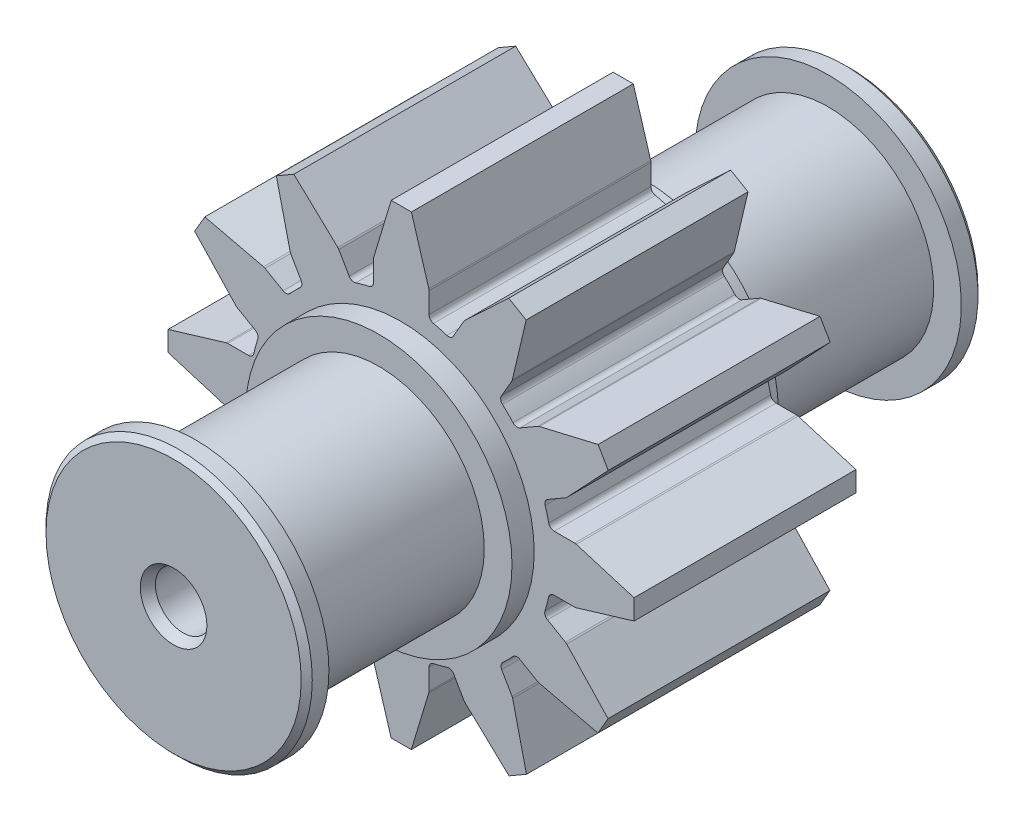
from build123d import *

# Parameters (mm, degrees)
EXTRUDE_1_DEPTH      = 20
SKETCH_3_R           = 12
EXTRUDE_2_DEPTH      = 2
EXTRUDE_START        = 2
SKETCH_4_R           = 12
EXTRUDE_3_DEPTH      = 2
SKETCH_5_R           = 9.5
EXTRUDE_4_DEPTH      = 16.5
SKETCH_6_R           = 12
EXTRUDE_5_DEPTH      = 2
CHAMFER_2_SIZE       = 0.5
EXTRUDE_START_2      = 16.5
SKETCH_7_R           = 9.5
EXTRUDE_6_DEPTH      = 16.5
SKETCH_8_R           = 12
EXTRUDE_7_DEPTH      = 2
CHAMFER_3_SIZE       = 0.5
SKETCH_15_R          = 2.5
CUT_EXTRUDE_13_DEPTH = 74
CHAMFER_6_SIZE       = 0.5
CHAMFER_6_SIZE2      = 0.866025404
CHAMFER_9_SIZE       = 0.5
CHAMFER_9_SIZE2      = 0.866025404


with BuildPart() as part:
    # Эскиз2 → Вытянуть1 (new body)
    with BuildSketch(Plane.XY):
        with BuildLine():
            Line((53.764538287, -2.946020686), (53.764538287, -1.077143616))
            ThreePointArc((53.764538287, -1.077143616), (53.759197394, -1.004257629), (53.743288818, -0.932928746))
            Line((53.743288818, -0.932928746), (52.174732421, 4.274212553))
            Line((52.174732421, 4.274212553), (50.354570926, 4.274212553))
            Line((50.354570926, 4.274212553), (48.785793437, -0.932919949))
            ThreePointArc((48.785793437, -0.932919949), (48.769880615, -1.004257948), (48.764538287, -1.077153679))
            Line((48.764538287, -1.077153679), (48.764538287, -2.953138509))
            ThreePointArc((48.764538287, -2.953138509), (48.653798767, -3.266947811), (48.370633173, -3.441752748))
            ThreePointArc((48.370633173, -3.441752748), (47.755574297, -3.590379289), (47.148101498, -3.767478327))
            ThreePointArc((47.148101498, -3.767478327), (46.816157953, -3.756991645), (46.564008916, -3.540849677))
            Line((46.564008916, -3.540849677), (45.628704767, -1.920855369))
            ThreePointArc((45.628704767, -1.920855369), (45.587636424, -1.860404698), (45.538194752, -1.806586362))
            Line((45.538194752, -1.806586362), (41.576214415, 1.918652085))
            Line((41.576214415, 1.918652085), (39.999908322, 1.008571338))
            Line((39.999908322, 1.008571338), (41.244873414, -4.285326434))
            ThreePointArc((41.244873414, -4.285326434), (41.266761505, -4.355063364), (41.298582779, -4.420864083))
            Line((41.298582779, -4.420864083), (42.233043669, -6.039397823))
            ThreePointArc((42.233043669, -6.039397823), (42.29400173, -6.366811555), (42.135803463, -6.659879713))
            ThreePointArc((42.135803463, -6.659879713), (41.671118276, -7.10145189), (41.227792451, -7.564464333))
            ThreePointArc((41.227792451, -7.564464333), (40.935062472, -7.721409797), (40.608582641, -7.660306282))
            Line((40.608582641, -7.660306282), (38.980519219, -6.720343428))
            ThreePointArc((38.980519219, -6.720343428), (38.914727656, -6.688525782), (38.845000744, -6.666638572))
            Line((38.845000744, -6.666638572), (33.551205899, -5.42147761))
            Line((33.551205899, -5.42147761), (32.641125152, -6.997783703))
            Line((32.641125152, -6.997783703), (36.36624071, -10.959946087))
            ThreePointArc((36.36624071, -10.959946087), (36.42007011, -11.009400187), (36.480534902, -11.050477203))
            Line((36.480534902, -11.050477203), (38.099195221, -11.984952893))
            ThreePointArc((38.099195221, -11.984952893), (38.3156739, -12.237948594), (38.325284093, -12.570781115))
            ThreePointArc((38.325284093, -12.570781115), (38.135802793, -13.215524272), (37.978453065, -13.868852647))
            ThreePointArc((37.978453065, -13.868852647), (37.803845806, -14.152755097), (37.48960436, -14.263843393))
            Line((37.48960436, -14.263843393), (35.609921104, -14.263843393))
            ThreePointArc((35.609921104, -14.263843393), (35.536992217, -14.269190608), (35.465623196, -14.285117883))
            Line((35.465623196, -14.285117883), (30.241497591, -15.859778889))
            Line((30.241497591, -15.859778889), (30.258564934, -17.673810753))
            Line((30.258564934, -17.673810753), (35.465697436, -19.242588243))
            ThreePointArc((35.465697436, -19.242588243), (35.537035435, -19.258501065), (35.609931166, -19.263843393))
            Line((35.609931166, -19.263843393), (37.515142589, -19.263843393))
            ThreePointArc((37.515142589, -19.263843393), (37.828138332, -19.373928448), (38.003309462, -19.655708734))
            ThreePointArc((38.003309462, -19.655708734), (38.149518751, -20.25162588), (38.322513601, -20.840325449))
            ThreePointArc((38.322513601, -20.840325449), (38.312380747, -21.172625221), (38.09610656, -21.425115396))
            Line((38.09610656, -21.425115396), (36.477531273, -22.359600274))
            ThreePointArc((36.477531273, -22.359600274), (36.417080602, -22.400668616), (36.363262266, -22.450110289))
            Line((36.363262266, -22.450110289), (32.638023819, -26.412090625))
            Line((32.638023819, -26.412090625), (33.548104566, -27.988396718))
            Line((33.548104566, -27.988396718), (38.837821827, -26.744414757))
            ThreePointArc((38.837821827, -26.744414757), (38.911454943, -26.720963772), (38.980594997, -26.686446567))
            Line((38.980594997, -26.686446567), (40.557311134, -25.740478688))
            ThreePointArc((40.557311134, -25.740478688), (40.887974912, -25.674653662), (41.185251899, -25.833706677))
            ThreePointArc((41.185251899, -25.833706677), (41.655272975, -26.327509287), (42.149482788, -26.797102185))
            ThreePointArc((42.149482788, -26.797102185), (42.308189645, -27.09030597), (42.247291035, -27.418098106))
            Line((42.247291035, -27.418098106), (41.313149687, -29.036078382))
            ThreePointArc((41.313149687, -29.036078382), (41.281332042, -29.101869945), (41.259444832, -29.171596858))
            Line((41.259444832, -29.171596858), (40.014283869, -34.465391703))
            Line((40.014283869, -34.465391703), (41.590589962, -35.37547245))
            Line((41.590589962, -35.37547245), (45.552970023, -31.650152239))
            ThreePointArc((45.552970023, -31.650152239), (45.602242473, -31.596552031), (45.643208409, -31.536364418))
            Line((45.643208409, -31.536364418), (46.589687492, -29.901332509))
            ThreePointArc((46.589687492, -29.901332509), (46.841408349, -29.685740418), (47.172658361, -29.674934436))
            ThreePointArc((47.172658361, -29.674934436), (47.763729285, -29.846529298), (48.361967201, -29.991170333))
            ThreePointArc((48.361967201, -29.991170333), (48.644883646, -30.166041654), (48.75550534, -30.479704745))
            Line((48.75550534, -30.479704745), (48.75550534, -32.34734856))
            ThreePointArc((48.75550534, -32.34734856), (48.760846232, -32.420234547), (48.776754809, -32.49156343))
            Line((48.776754809, -32.49156343), (50.345311205, -37.698704729))
            Line((50.345311205, -37.698704729), (52.1654727, -37.698704729))
            Line((52.1654727, -37.698704729), (53.734250189, -32.491572227))
            ThreePointArc((53.734250189, -32.491572227), (53.750163012, -32.420234228), (53.75550534, -32.347338497))
            Line((53.75550534, -32.347338497), (53.75550534, -30.477514017))
            ThreePointArc((53.75550534, -30.477514017), (53.866087201, -30.163900379), (54.148919394, -29.989006661))
            ThreePointArc((54.148919394, -29.989006661), (54.776030579, -29.836482847), (55.395187259, -29.654337418))
            ThreePointArc((55.395187259, -29.654337418), (55.727840657, -29.664117847), (55.980669977, -29.880523195))
            Line((55.980669977, -29.880523195), (56.918293093, -31.50453407))
            ThreePointArc((56.918293093, -31.50453407), (56.959361435, -31.564984741), (57.008803108, -31.618803077))
            Line((57.008803108, -31.618803077), (60.970783444, -35.344041525))
            Line((60.970783444, -35.344041525), (62.547089537, -34.433960777))
            Line((62.547089537, -34.433960777), (61.302124446, -29.140063005))
            ThreePointArc((61.302124446, -29.140063005), (61.280236354, -29.070326075), (61.248415081, -29.004525356))
            Line((61.248415081, -29.004525356), (60.313352567, -27.384949575))
            ThreePointArc((60.313352567, -27.384949575), (60.252285616, -27.058233892), (60.409547147, -26.765418044))
            ThreePointArc((60.409547147, -26.765418044), (60.874734414, -26.320800568), (61.318355435, -25.854662946))
            ThreePointArc((61.318355435, -25.854662946), (61.611362594, -25.69669226), (61.938606865, -25.757676849))
            Line((61.938606865, -25.757676849), (63.556770089, -26.691923822))
            ThreePointArc((63.556770089, -26.691923822), (63.622561652, -26.723741467), (63.692288565, -26.745628677))
            Line((63.692288565, -26.745628677), (68.986083409, -27.990789639))
            Line((68.986083409, -27.990789639), (69.896164156, -26.414483546))
            Line((69.896164156, -26.414483546), (66.171043874, -22.452316137))
            ThreePointArc((66.171043874, -22.452316137), (66.117219766, -22.402866229), (66.056761375, -22.361791772))
            Line((66.056761375, -22.361791772), (64.43714748, -21.426707253))
            ThreePointArc((64.43714748, -21.426707253), (64.220913014, -21.174319639), (64.210673714, -20.84212691))
            ThreePointArc((64.210673714, -20.84212691), (64.390016693, -20.228801746), (64.540344527, -19.607727513))
            ThreePointArc((64.540344527, -19.607727513), (64.715163733, -19.324615398), (65.028941656, -19.213901173))
            Line((65.028941656, -19.213901173), (66.888769323, -19.213901173))
            ThreePointArc((66.888769323, -19.213901173), (66.961655311, -19.208560281), (67.032984194, -19.192651704))
            Line((67.032984194, -19.192651704), (72.240125492, -17.624095307))
            Line((72.240125492, -17.624095307), (72.240125492, -15.803933813))
            Line((72.240125492, -15.803933813), (67.033013036, -14.235162363))
            ThreePointArc((67.033013036, -14.235162363), (66.961654766, -14.219246553), (66.888738326, -14.213907214))
            Line((66.888738326, -14.213907214), (65.038418761, -14.214058869))
            ThreePointArc((65.038418761, -14.214058869), (64.724765213, -14.103477871), (64.549862276, -13.820607462))
            ThreePointArc((64.549862276, -13.820607462), (64.40200748, -13.210628208), (64.226184375, -12.608115166))
            ThreePointArc((64.226184375, -12.608115166), (64.236662079, -12.276162568), (64.452807408, -12.024004868))
            Line((64.452807408, -12.024004868), (66.072795877, -11.088704089))
            ThreePointArc((66.072795877, -11.088704089), (66.133246547, -11.047635747), (66.187064884, -10.998194074))
            Line((66.187064884, -10.998194074), (69.912303331, -7.036213738))
            Line((69.912303331, -7.036213738), (69.002222584, -5.459907645))
            Line((69.002222584, -5.459907645), (63.708324812, -6.704872737))
            ThreePointArc((63.708324812, -6.704872737), (63.638587881, -6.726760828), (63.572787163, -6.758582102))
            Line((63.572787163, -6.758582102), (61.954455243, -7.692926471))
            ThreePointArc((61.954455243, -7.692926471), (61.626900937, -7.75386248), (61.3337823, -7.595475342))
            ThreePointArc((61.3337823, -7.595475342), (60.870851004, -7.108824873), (60.384451797, -6.645629585))
            ThreePointArc((60.384451797, -6.645629585), (60.226244716, -6.352559068), (60.287201748, -6.025138774))
            Line((60.287201748, -6.025138774), (61.21857227, -4.41195771))
            ThreePointArc((61.21857227, -4.41195771), (61.250389916, -4.346166146), (61.272277126, -4.276439234))
            Line((61.272277126, -4.276439234), (62.517438088, 1.017355611))
            Line((62.517438088, 1.017355611), (60.941131995, 1.927436358))
            Line((60.941131995, 1.927436358), (56.978964585, -1.797683924))
            ThreePointArc((56.978964585, -1.797683924), (56.929514677, -1.851508033), (56.88844022, -1.911966424))
            Line((56.88844022, -1.911966424), (55.953232083, -3.531794433))
            ThreePointArc((55.953232083, -3.531794433), (55.70097994, -3.747976393), (55.368928673, -3.758356204))
            ThreePointArc((55.368928673, -3.758356204), (54.767086452, -3.582459006), (54.157776241, -3.434489586))
            ThreePointArc((54.157776241, -3.434489586), (53.875063626, -3.259564126), (53.764538287, -2.946020686))
        make_face()
    extrude(amount=EXTRUDE_1_DEPTH)

    # Эскиз3 → Вытянуть2 (add)
    with BuildSketch(Plane(origin=(0, 0, 0), x_dir=(-1, 0, 0), z_dir=(0, 0, -1))):
        with Locations((-51.240125492, -16.733104028)):
            Circle(SKETCH_3_R)
    extrude(amount=EXTRUDE_2_DEPTH)

    # Эскиз4 → Вытянуть3 (add)
    with BuildSketch(Plane.XY.offset(20).offset(EXTRUDE_START)):
        with Locations((51.240125492, -16.733104028)):
            Circle(SKETCH_4_R)
    extrude(amount=-EXTRUDE_3_DEPTH)

    # Эскиз5 → Вытянуть4 (add)
    with BuildSketch(Plane(origin=(0, 0, -2), x_dir=(-1, 0, 0), z_dir=(0, 0, -1))):
        with Locations((-51.240125492, -16.733104028)):
            Circle(SKETCH_5_R)
    extrude(amount=EXTRUDE_4_DEPTH)

    # Эскиз6 → Вытянуть5 (add)
    with BuildSketch(Plane(origin=(0, 0, -18.5), x_dir=(-1, 0, 0), z_dir=(0, 0, -1))):
        with Locations((-51.240125492, -16.733104028)):
            Circle(SKETCH_6_R)
    extrude(amount=EXTRUDE_5_DEPTH)

    # Фаска2
    chamfer_2_edges = [part.edges().sort_by_distance(p)[0] for p in [
        (63.240125492, -16.733104028, -20.5),
    ]]
    chamfer(chamfer_2_edges, length=CHAMFER_2_SIZE)

    # Эскиз7 → Вытянуть6 (add)
    with BuildSketch(Plane.XY.offset(22).offset(EXTRUDE_START_2)):
        with Locations((51.240125492, -16.733104028)):
            Circle(SKETCH_7_R)
    extrude(amount=-EXTRUDE_6_DEPTH)

    # Эскиз8 → Вытянуть7 (add)
    with BuildSketch(Plane.XY.offset(38.5).offset(EXTRUDE_START)):
        with Locations((51.240125492, -16.733104028)):
            Circle(SKETCH_8_R)
    extrude(amount=-EXTRUDE_7_DEPTH)

    # Фаска3
    chamfer_3_edges = [part.edges().sort_by_distance(p)[0] for p in [
        (39.240125492, -16.733104028, 40.5),
    ]]
    chamfer(chamfer_3_edges, length=CHAMFER_3_SIZE)

    # Эскиз15 → Вытянуть13 (cut)
    with BuildSketch(Plane(origin=(0, 0, -20.5), x_dir=(-1, 0, 0), z_dir=(0, 0, -1))):
        with Locations((-51.240125492, -16.733104028)):
            Circle(SKETCH_15_R)
    extrude(amount=-CUT_EXTRUDE_13_DEPTH, mode=Mode.SUBTRACT)

    # Фаска6
    chamfer_6_edges = [part.edges().sort_by_distance(p)[0] for p in [
        (53.740125492, -16.733104028, -20.5),
    ]]
    chamfer_6_side = [part.faces().sort_by_distance(p)[0] for p in [
        (62.414856373, -16.733104028, -20.5),
    ]]
    chamfer(chamfer_6_edges, length=CHAMFER_6_SIZE, length2=CHAMFER_6_SIZE2, reference=chamfer_6_side[0])

    # Фаска9
    chamfer_9_edges = [part.edges().sort_by_distance(p)[0] for p in [
        (53.740125492, -16.733104028, 40.5),
    ]]
    chamfer_9_side = [part.faces().sort_by_distance(p)[0] for p in [
        (40.065394612, -16.733104028, 40.5),
    ]]
    chamfer(chamfer_9_edges, length=CHAMFER_9_SIZE, length2=CHAMFER_9_SIZE2, reference=chamfer_9_side[0])


solid = part.part
